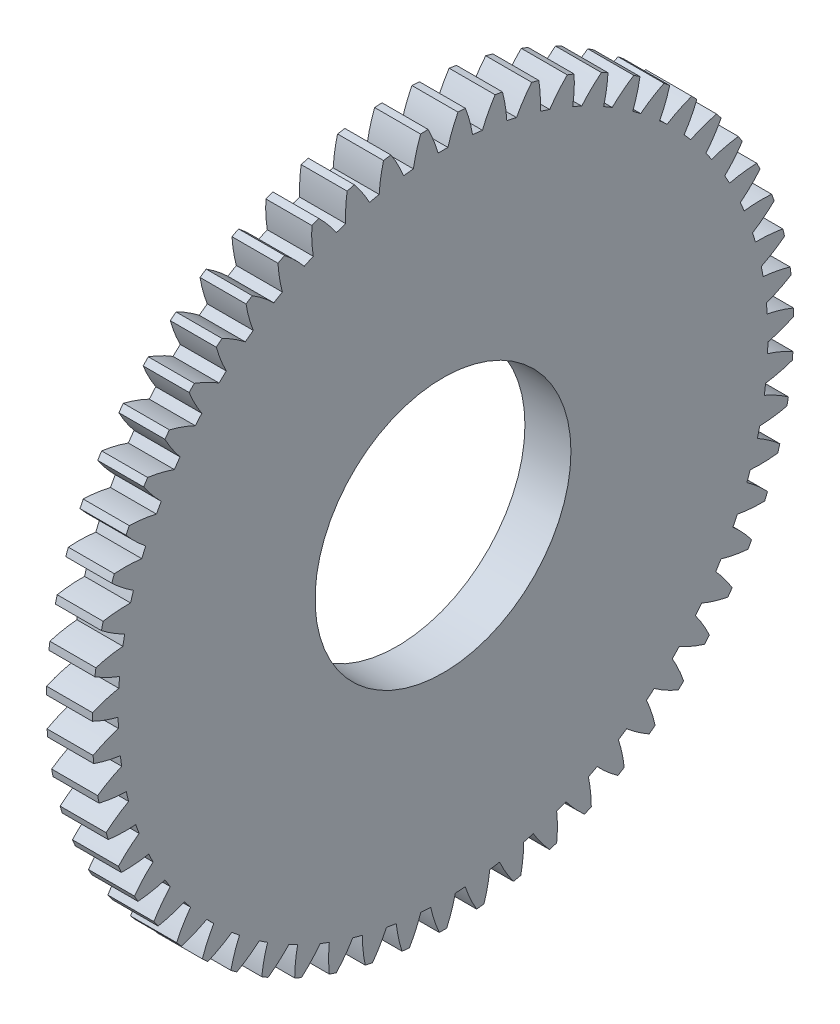
from build123d import *

# Parameters (mm, degrees)
BASPROSKE_W        = 4
BASPROSKE_H        = 30.5
TOOTHCUT_DEPTH     = 44.318587235
TEETHCUTS_COUNT    = 59
TEETHCUTS_ANGLE    = 353.898305085
BORSKE_R           = 4
BORE_DEPTH         = 50.0000508
SKETCH1_R          = 11.125
CUT_EXTRUDE1_DEPTH = 10


with BuildPart() as part:
    # BasProSke → Base-Revolve (revolve)
    with BuildSketch(Plane(origin=(0, 0, 0), x_dir=(1, 0, 0), z_dir=(0, 1, 0))):
        with Locations((2, 15.25)):
            Rectangle(BASPROSKE_W, BASPROSKE_H)
    revolve(axis=Axis((-10, 0, 0), (1, 0, 0)))

    # TooCutSke → ToothCut (cut, through all)
    with BuildSketch(Plane(origin=(0, 0, 0), x_dir=(0, 0, -1), z_dir=(1, 0, 0))):
        with BuildLine():
            ThreePointArc((0.430794105, 28.245715028), (0, 28.249), (-0.430794105, 28.245715028))
            ThreePointArc((-0.430794105, 28.245715028), (-0.814615912, 29.394097581), (-1.314100174, 30.49710127))
            ThreePointArc((-1.314100174, 30.49710127), (0, 30.5254), (1.314100174, 30.49710127))
            ThreePointArc((1.314100174, 30.49710127), (0.814615912, 29.394097581), (0.430794105, 28.245715028))
        make_face()
    toothcut = extrude(amount=TOOTHCUT_DEPTH, mode=Mode.SUBTRACT)

    # TeethCuts: ToothCut ×59 about axis
    teethcuts_axis = Axis((-10, 0, 0), (1, 0, 0))
    for i in range(1, TEETHCUTS_COUNT):
        add(toothcut.rotate(teethcuts_axis, i * TEETHCUTS_ANGLE / (TEETHCUTS_COUNT - 1)), mode=Mode.SUBTRACT)

    # BorSke → Bore (cut, symmetric)
    with BuildSketch(Plane(origin=(0, 0, 0), x_dir=(0, 0, -1), z_dir=(1, 0, 0))):
        Circle(BORSKE_R)
    extrude(amount=BORE_DEPTH, both=True, mode=Mode.SUBTRACT)

    # Sketch1 → Cut-Extrude1 (cut)
    with BuildSketch(Plane(origin=(4, 0, 0), x_dir=(0, 0, -1), z_dir=(1, 0, 0))):
        Circle(SKETCH1_R)
    extrude(amount=-CUT_EXTRUDE1_DEPTH, mode=Mode.SUBTRACT)


solid = part.part
